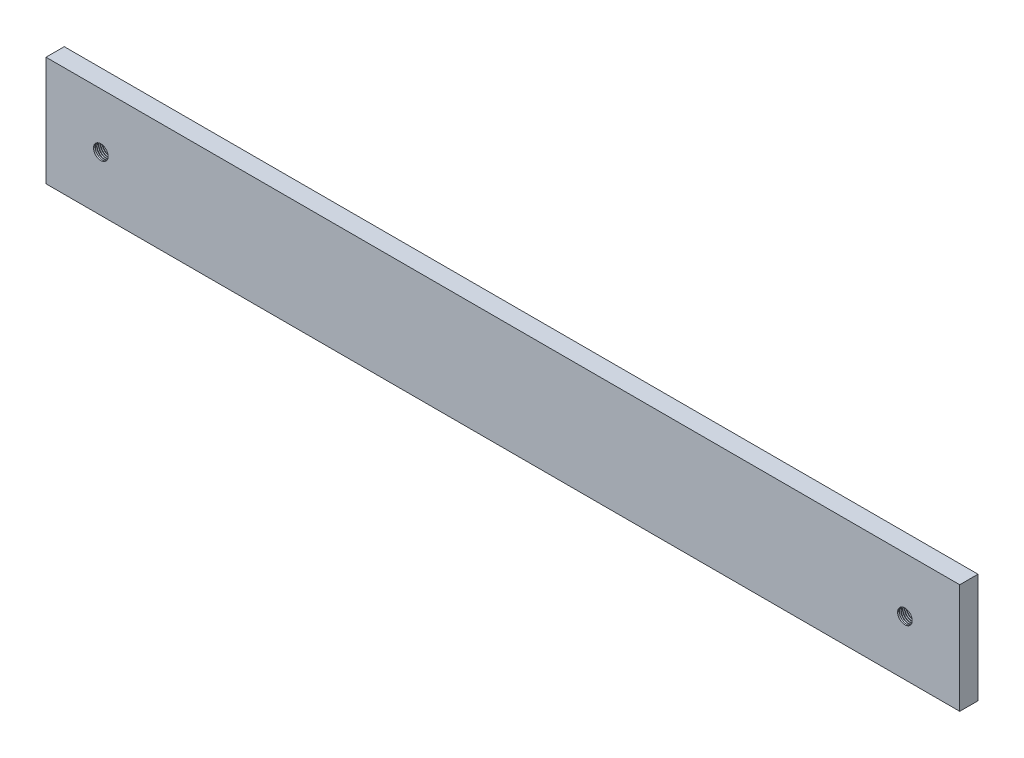
from build123d import *
from build123d.topology import SkipClean

# Parameters (mm, degrees)
SZKIC1_W                             = 500
SZKIC1_H                             = 10
DODANIE_WYCI_GNI_CIE1_DEPTH          = 60
OTWORY_USTALAJ_CE_8_0MM2_D           = 8
OTWORY_USTALAJ_CE_8_0MM2_CSINK_D     = 8.05
OTWORY_USTALAJ_CE_8_0MM2_CSINK_ANGLE = 90
GWINT1_PITCH                         = 1
GWINT2_PITCH                         = 1


with BuildPart() as part:
    # Szkic1 → Dodanie-wyciągnięcie1 (new body)
    with BuildSketch(Plane(origin=(0, 0, 0), x_dir=(1, 0, 0), z_dir=(0, 1, 0))):
        with Locations((8.930940834, 5)):
            Rectangle(SZKIC1_W, SZKIC1_H)
    extrude(amount=DODANIE_WYCI_GNI_CIE1_DEPTH)

    # Otwory ustalające Ø8.0mm2 (through all)
    with Locations(Plane(origin=(0, 0, -10), x_dir=(-1, 0, 0), z_dir=(0, 0, -1))):
        with Locations((211.069059166, 30), (-228.930940834, 30)):
            CounterSinkHole(OTWORY_USTALAJ_CE_8_0MM2_D / 2, OTWORY_USTALAJ_CE_8_0MM2_CSINK_D / 2, counter_sink_angle=OTWORY_USTALAJ_CE_8_0MM2_CSINK_ANGLE)

    # Gwint1: the profile of Profil gwintu1 profile screwed along a right-hand helix of 10 turns, 8 arcs to a turn; built about Z, then put on its axis
    with SkipClean():  # the faces are left unmerged after this step: merging them gives an invalid solid
        gwint1_z = Axis((0, 0, 0), (0, 0, 1))
        gwint1_corners = [(3.9997, 0, -0.000173205), (4.541265875, 0, 0.312499999), (4.541265875, 0, 0.437499999), (3.9997, 0, 0.750173202)]
        with BuildLine(mode=Mode.PRIVATE) as gwint1_profile:
            Line(gwint1_corners[0], gwint1_corners[1])
            Line(gwint1_corners[1], gwint1_corners[2])
            Line(gwint1_corners[2], gwint1_corners[3])
            Line(gwint1_corners[3], gwint1_corners[0])
        gwint1_cap = Face(gwint1_profile.wire())
        gwint1_turn_angles = [0, 22.5, 45, 67.5, 90, 112.5, 135, 157.5, 180, 202.5, 225, 247.5, 270, 292.5, 315, 337.5, 360]
        gwint1_turn_weights = [1, 0.9238795325112867, 1, 0.9238795325112867, 1, 0.9238795325112867, 1, 0.9238795325112867, 1, 0.9238795325112867, 1, 0.9238795325112867, 1, 0.9238795325112867, 1, 0.9238795325112867, 1]
        gwint1_turn_rails = [Edge.make_bspline([Vector(p[0], p[1], 0).rotate(gwint1_z, gwint1_turn_angles[k]) / gwint1_turn_weights[k] + Vector(0, 0, p[2] + GWINT1_PITCH * gwint1_turn_angles[k] / 360) for k in range(17)], [0, 0, 0, 1, 1, 2, 2, 3, 3, 4, 4, 5, 5, 6, 6, 7, 7, 8, 8, 8], 2, gwint1_turn_weights) for p in gwint1_corners]
        gwint1_turn_sides = [Face.make_surface_from_curves(gwint1_turn_rails[p[0]], gwint1_turn_rails[p[1]]) for p in [(0, 1), (1, 2), (2, 3), (3, 0)]]
        gwint1 = Plane(origin=(228.930940834, 30, 0), x_dir=(-1, 0, 0), z_dir=(0, 0, -1)) * Solid(Shell([*[p.moved(Location((0, 0, GWINT1_PITCH * i))) for i in range(10) for p in gwint1_turn_sides], gwint1_cap, gwint1_cap.rotate(gwint1_z, 3600).moved(Location((0, 0, GWINT1_PITCH * 3600 / 360)))]))
        add(gwint1, mode=Mode.SUBTRACT)

    # Gwint2: the profile of Profil gwintu2 profile screwed along a right-hand helix of 10 turns, 8 arcs to a turn; built about Z, then put on its axis
    with SkipClean():  # the faces are left unmerged after this step: merging them gives an invalid solid
        gwint2_z = Axis((0, 0, 0), (0, 0, 1))
        gwint2_corners = [(3.9997, 0, -0.000173205), (4.541265875, 0, 0.312499999), (4.541265875, 0, 0.437499999), (3.9997, 0, 0.750173202)]
        with BuildLine(mode=Mode.PRIVATE) as gwint2_profile:
            Line(gwint2_corners[0], gwint2_corners[1])
            Line(gwint2_corners[1], gwint2_corners[2])
            Line(gwint2_corners[2], gwint2_corners[3])
            Line(gwint2_corners[3], gwint2_corners[0])
        gwint2_cap = Face(gwint2_profile.wire())
        gwint2_turn_angles = [0, 22.5, 45, 67.5, 90, 112.5, 135, 157.5, 180, 202.5, 225, 247.5, 270, 292.5, 315, 337.5, 360]
        gwint2_turn_weights = [1, 0.9238795325112867, 1, 0.9238795325112867, 1, 0.9238795325112867, 1, 0.9238795325112867, 1, 0.9238795325112867, 1, 0.9238795325112867, 1, 0.9238795325112867, 1, 0.9238795325112867, 1]
        gwint2_turn_rails = [Edge.make_bspline([Vector(p[0], p[1], 0).rotate(gwint2_z, gwint2_turn_angles[k]) / gwint2_turn_weights[k] + Vector(0, 0, p[2] + GWINT2_PITCH * gwint2_turn_angles[k] / 360) for k in range(17)], [0, 0, 0, 1, 1, 2, 2, 3, 3, 4, 4, 5, 5, 6, 6, 7, 7, 8, 8, 8], 2, gwint2_turn_weights) for p in gwint2_corners]
        gwint2_turn_sides = [Face.make_surface_from_curves(gwint2_turn_rails[p[0]], gwint2_turn_rails[p[1]]) for p in [(0, 1), (1, 2), (2, 3), (3, 0)]]
        gwint2 = Plane(origin=(-211.069059166, 30, 0), x_dir=(-1, 0, 0), z_dir=(0, 0, -1)) * Solid(Shell([*[p.moved(Location((0, 0, GWINT2_PITCH * i))) for i in range(10) for p in gwint2_turn_sides], gwint2_cap, gwint2_cap.rotate(gwint2_z, 3600).moved(Location((0, 0, GWINT2_PITCH * 3600 / 360)))]))
        add(gwint2, mode=Mode.SUBTRACT)


solid = part.part
